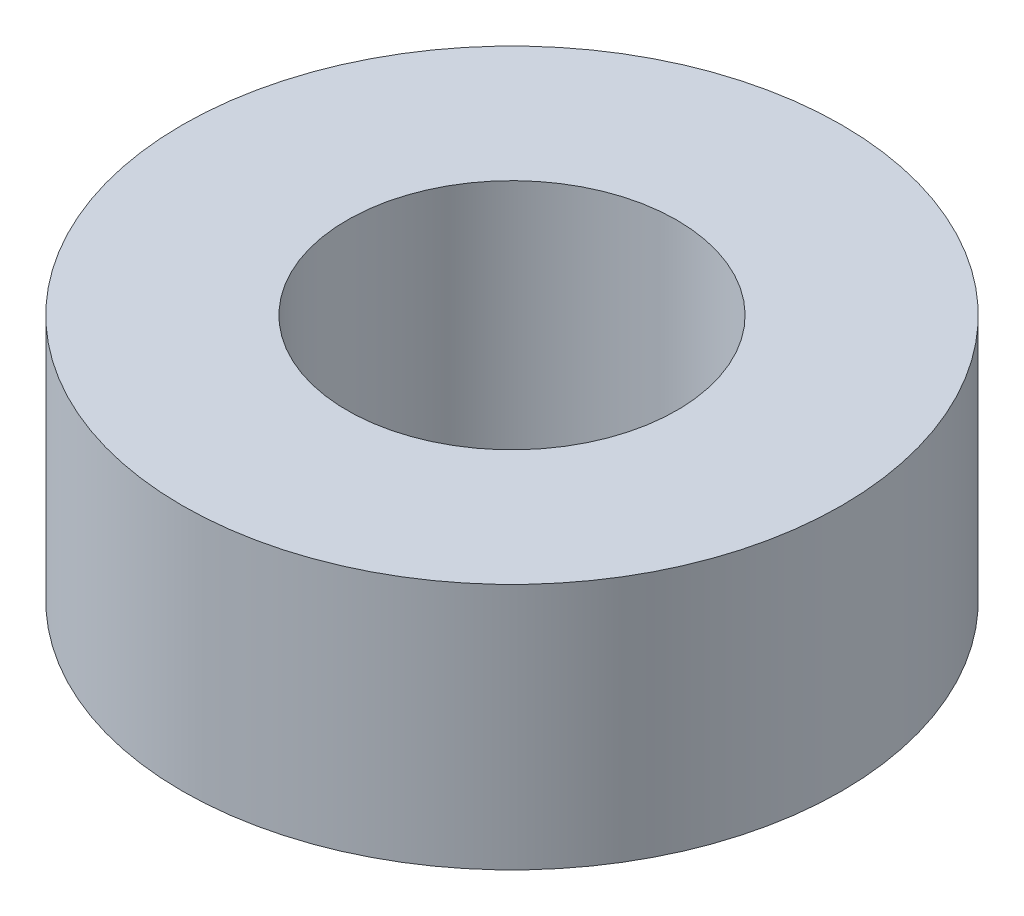
from build123d import *

# Parameters (mm, degrees)
SKETCH1_W = 2
SKETCH1_H = 3


with BuildPart() as part:
    # Sketch1 → Revolve1 (revolve)
    with BuildSketch(Plane.XY):
        with Locations((-3, 0)):
            Rectangle(SKETCH1_W, SKETCH1_H)
    revolve(axis=Axis((0, 0, 0), (0, 1, 0)))


solid = part.part
